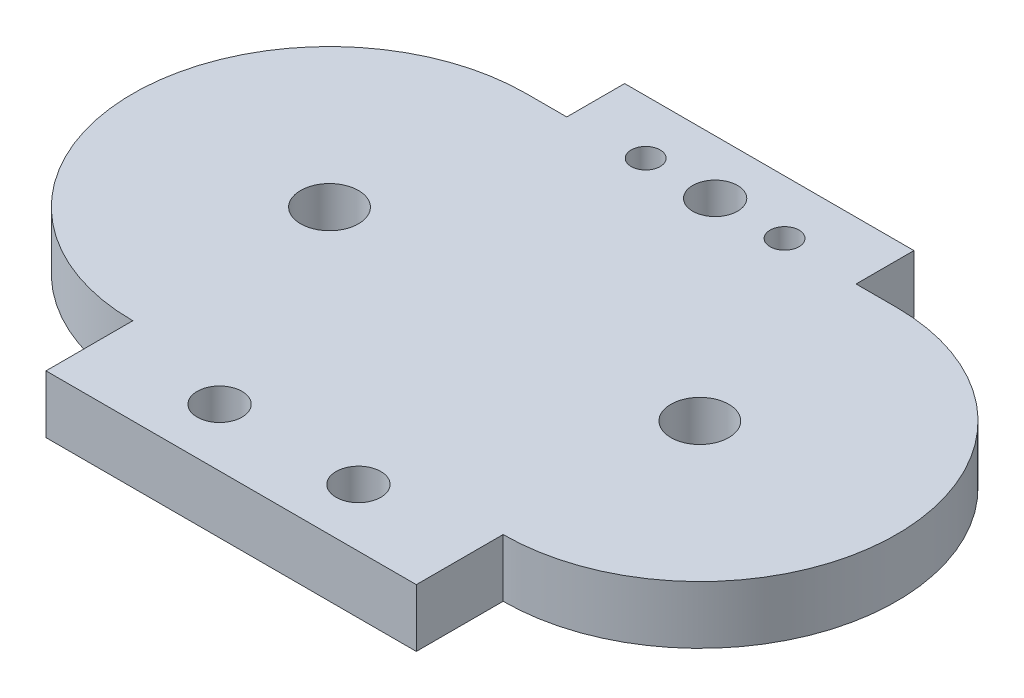
from build123d import *

# Parameters (mm, degrees)
SKETCH1_R                    = 3.175
SKETCH1_R_2                  = 1.5875
BOSS_EXTRUDE1_DEPTH          = 6.35
F_10_0_1935_DIAMETER_HOLE1_D = 4.9149


with BuildPart() as part:
    # Sketch1 → Boss-Extrude1 (new body)
    with BuildSketch(Plane(origin=(0, 0, 0), x_dir=(1, 0, 0), z_dir=(0, 1, 0))):
        with BuildLine():
            Line((-15.875, 21.59), (-20.32, 21.59))
            ThreePointArc((-20.32, 21.59), (-41.91, 0), (-20.32, -21.59))
            Line((-20.32, -21.59), (-20.32, -31.115))
            Line((-20.32, -31.115), (20.32, -31.115))
            Line((20.32, -31.115), (20.32, -21.59))
            ThreePointArc((20.32, -21.59), (41.91, 0), (20.32, 21.59))
            Line((20.32, 21.59), (15.875, 21.59))
            Line((15.875, 21.59), (15.875, 27.94))
            Line((15.875, 27.94), (-15.875, 27.94))
            Line((-15.875, 27.94), (-15.875, 21.59))
        make_face()
        with Locations((-20.32, 0)):
            Circle(SKETCH1_R, mode=Mode.SUBTRACT)
        with Locations((-7.62, 21.997045256)):
            Circle(SKETCH1_R_2, mode=Mode.SUBTRACT)
        with Locations((20.32, 0)):
            Circle(SKETCH1_R, mode=Mode.SUBTRACT)
        with Locations((7.62, 21.997045256)):
            Circle(SKETCH1_R_2, mode=Mode.SUBTRACT)
    extrude(amount=BOSS_EXTRUDE1_DEPTH)

    # #10 (0.1935) Diameter Hole1 (through all)
    with Locations(Plane(origin=(0, 6.35, 0), x_dir=(1, 0, 0), z_dir=(0, 1, 0))):
        with Locations((0, 21.997045256), (-7.62, -24.765), (7.62, -24.765)):
            Hole(F_10_0_1935_DIAMETER_HOLE1_D / 2)


solid = part.part
